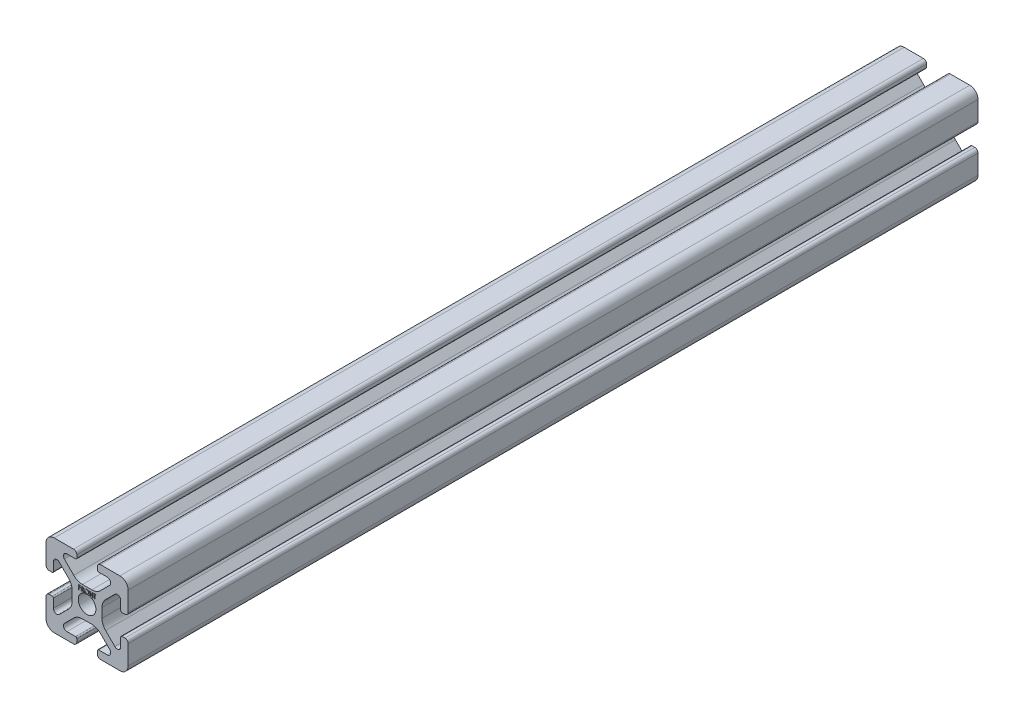
from build123d import *

# Parameters (mm, degrees)
SKETCH1_R           = 2.1463
BOSS_EXTRUDE1_DEPTH = 206.82
WRAP1_DEPTH         = 0.1


# Read off the part's stored shape, not the designer's step: Wrap1
with BuildPart() as part:
    # Sketch1 → Boss-Extrude1 (new body)
    with BuildSketch(Plane.XY):
        with BuildLine():
            Line((-9.9949, 7.9883), (-9.9949, 3.2893))
            ThreePointArc((-9.9949, 3.2893), (-9.76427588, 2.73252412), (-9.2075, 2.5019))
            Line((-9.2075, 2.5019), (-8.4963, 2.5019))
            ThreePointArc((-8.4963, 2.5019), (-8.280773853, 2.591173853), (-8.1915, 2.8067))
            Line((-8.1915, 2.8067), (-8.1915, 4.9149))
            ThreePointArc((-8.1915, 4.9149), (-7.674065253, 5.689295824), (-6.760603096, 5.507596904))
            Line((-6.760603096, 5.507596904), (-4.505765747, 3.252759555))
            ThreePointArc((-4.505765747, 3.252759555), (-3.856054457, 2.280397894), (-3.627906192, 1.133419111))
            Line((-3.627906192, 1.133419111), (-3.627906192, -1.133419111))
            ThreePointArc((-3.627906192, -1.133419111), (-3.856054457, -2.280397894), (-4.505765747, -3.252759555))
            Line((-4.505765747, -3.252759555), (-6.760603096, -5.507596904))
            ThreePointArc((-6.760603096, -5.507596904), (-7.674065253, -5.689295824), (-8.1915, -4.9149))
            Line((-8.1915, -4.9149), (-8.1915, -2.8067))
            ThreePointArc((-8.1915, -2.8067), (-8.280773853, -2.591173853), (-8.4963, -2.5019))
            Line((-8.4963, -2.5019), (-9.2075, -2.5019))
            ThreePointArc((-9.2075, -2.5019), (-9.76427588, -2.73252412), (-9.9949, -3.2893))
            Line((-9.9949, -3.2893), (-9.9949, -7.9883))
            ThreePointArc((-9.9949, -7.9883), (-9.407180467, -9.407180467), (-7.9883, -9.9949))
            Line((-7.9883, -9.9949), (-3.2893, -9.9949))
            ThreePointArc((-3.2893, -9.9949), (-2.73252412, -9.76427588), (-2.5019, -9.2075))
            Line((-2.5019, -9.2075), (-2.5019, -8.4963))
            ThreePointArc((-2.5019, -8.4963), (-2.591173853, -8.280773853), (-2.8067, -8.1915))
            Line((-2.8067, -8.1915), (-4.9149, -8.1915))
            ThreePointArc((-4.9149, -8.1915), (-5.689295824, -7.674065253), (-5.507596904, -6.760603096))
            Line((-5.507596904, -6.760603096), (-3.252759555, -4.505765747))
            ThreePointArc((-3.252759555, -4.505765747), (-2.280397894, -3.856054457), (-1.133419111, -3.627906192))
            Line((-1.133419111, -3.627906192), (1.133419111, -3.627906192))
            ThreePointArc((1.133419111, -3.627906192), (2.280397894, -3.856054457), (3.252759555, -4.505765747))
            Line((3.252759555, -4.505765747), (5.507596904, -6.760603096))
            ThreePointArc((5.507596904, -6.760603096), (5.689295824, -7.674065253), (4.9149, -8.1915))
            Line((4.9149, -8.1915), (2.8067, -8.1915))
            ThreePointArc((2.8067, -8.1915), (2.591173853, -8.280773853), (2.5019, -8.4963))
            Line((2.5019, -8.4963), (2.5019, -9.2075))
            ThreePointArc((2.5019, -9.2075), (2.73252412, -9.76427588), (3.2893, -9.9949))
            Line((3.2893, -9.9949), (7.9883, -9.9949))
            ThreePointArc((7.9883, -9.9949), (9.407180467, -9.407180467), (9.9949, -7.9883))
            Line((9.9949, -7.9883), (9.9949, -3.2893))
            ThreePointArc((9.9949, -3.2893), (9.76427588, -2.73252412), (9.2075, -2.5019))
            Line((9.2075, -2.5019), (8.4963, -2.5019))
            ThreePointArc((8.4963, -2.5019), (8.280773853, -2.591173853), (8.1915, -2.8067))
            Line((8.1915, -2.8067), (8.1915, -4.9149))
            ThreePointArc((8.1915, -4.9149), (7.674065253, -5.689295824), (6.760603096, -5.507596904))
            Line((6.760603096, -5.507596904), (4.505765747, -3.252759555))
            ThreePointArc((4.505765747, -3.252759555), (3.856054457, -2.280397894), (3.627906192, -1.133419111))
            Line((3.627906192, -1.133419111), (3.627906192, 1.133419111))
            ThreePointArc((3.627906192, 1.133419111), (3.856054457, 2.280397894), (4.505765747, 3.252759555))
            Line((4.505765747, 3.252759555), (6.760603096, 5.507596904))
            ThreePointArc((6.760603096, 5.507596904), (7.674065253, 5.689295824), (8.1915, 4.9149))
            Line((8.1915, 4.9149), (8.1915, 2.8067))
            ThreePointArc((8.1915, 2.8067), (8.280773853, 2.591173853), (8.4963, 2.5019))
            Line((8.4963, 2.5019), (9.2075, 2.5019))
            ThreePointArc((9.2075, 2.5019), (9.76427588, 2.73252412), (9.9949, 3.2893))
            Line((9.9949, 3.2893), (9.9949, 7.9883))
            ThreePointArc((9.9949, 7.9883), (9.407180467, 9.407180467), (7.9883, 9.9949))
            Line((7.9883, 9.9949), (3.2893, 9.9949))
            ThreePointArc((3.2893, 9.9949), (2.73252412, 9.76427588), (2.5019, 9.2075))
            Line((2.5019, 9.2075), (2.5019, 8.4963))
            ThreePointArc((2.5019, 8.4963), (2.591173853, 8.280773853), (2.8067, 8.1915))
            Line((2.8067, 8.1915), (4.9149, 8.1915))
            ThreePointArc((4.9149, 8.1915), (5.689295824, 7.674065253), (5.507596904, 6.760603096))
            Line((5.507596904, 6.760603096), (3.252759555, 4.505765747))
            ThreePointArc((3.252759555, 4.505765747), (2.280397894, 3.856054457), (1.133419111, 3.627906192))
            Line((1.133419111, 3.627906192), (-1.133419111, 3.627906192))
            ThreePointArc((-1.133419111, 3.627906192), (-2.280397894, 3.856054457), (-3.252759555, 4.505765747))
            Line((-3.252759555, 4.505765747), (-5.507596904, 6.760603096))
            ThreePointArc((-5.507596904, 6.760603096), (-5.689295824, 7.674065253), (-4.9149, 8.1915))
            Line((-4.9149, 8.1915), (-2.8067, 8.1915))
            ThreePointArc((-2.8067, 8.1915), (-2.591173853, 8.280773853), (-2.5019, 8.4963))
            Line((-2.5019, 8.4963), (-2.5019, 9.2075))
            ThreePointArc((-2.5019, 9.2075), (-2.73252412, 9.76427588), (-3.2893, 9.9949))
            Line((-3.2893, 9.9949), (-7.9883, 9.9949))
            ThreePointArc((-7.9883, 9.9949), (-9.407180467, 9.407180467), (-9.9949, 7.9883))
        make_face()
        Circle(SKETCH1_R, mode=Mode.SUBTRACT)
    extrude(amount=BOSS_EXTRUDE1_DEPTH)

    # Wrap1 outline → Wrap1 (add)
    # profile 1 of 5: a face of its own
    with BuildSketch(Plane.XY.offset(206.82)):
        with BuildLine():
            add(Edge.make_bspline(
                [(-1.158854167, 3.1463), (-1.145499559, 3.146255547), (-1.119857232, 3.146170192), (-1.083122011, 3.14569426), (-1.049742841, 3.144330158), (-1.019737172, 3.143156277), (-0.993105557, 3.141015722), (-0.969766331, 3.138969823), (-0.949826989, 3.136291634), (-0.937756745, 3.133804371), (-0.932291667, 3.132678205)],
                knots=[0, 0, 0, 0, 0.176257755, 0.338434414, 0.484822051, 0.617157578, 0.734698361, 0.837385184, 0.926372421, 1, 1, 1, 1], degree=3))
            Line((-1.158854167, 3.1463), (-1.358974359, 3.1463))
            Line((-1.358974359, 3.1463), (-1.358974359, 2.1463))
            Line((-1.358974359, 2.1463), (-1.269230769, 2.1463))
            Line((-1.269230769, 2.1463), (-1.269230769, 2.607838462))
            Line((-1.269230769, 2.607838462), (-1.196314103, 2.607838462))
            Line((-1.196314103, 2.607838462), (-0.828926282, 2.1463))
            Line((-0.828926282, 2.1463), (-0.717948718, 2.1463))
            Line((-0.717948718, 2.1463), (-1.085336538, 2.607838462))
            add(Edge.make_bspline(
                [(-0.730769231, 2.878872115), (-0.731188945, 2.8655478), (-0.732007915, 2.839548609), (-0.739643659, 2.801816929), (-0.752151236, 2.766619982), (-0.769386461, 2.734002085), (-0.791334883, 2.704599043), (-0.817713395, 2.678773199), (-0.848536712, 2.657161795), (-0.877230802, 2.64217528), (-0.902577717, 2.632577306), (-0.923444377, 2.625824061), (-0.946206371, 2.620606356), (-0.970645609, 2.615932033), (-0.996863797, 2.612402977), (-1.024798094, 2.609818236), (-1.054468423, 2.608202794), (-1.074851014, 2.607962221), (-1.085336538, 2.607838462)],
                knots=[0, 0, 0, 0, 0.078780236, 0.153720644, 0.22671353, 0.299191166, 0.371189997, 0.443006414, 0.516689173, 0.593217217, 0.633872918, 0.676989142, 0.722899506, 0.771958611, 0.824211323, 0.879378651, 0.937948119, 1, 1, 1, 1], degree=3))
            add(Edge.make_bspline(
                [(-0.932291667, 3.132678205), (-0.924975488, 3.130870558), (-0.910499206, 3.127293825), (-0.88965633, 3.119733939), (-0.869795094, 3.110985475), (-0.850998002, 3.100710127), (-0.833359204, 3.088831618), (-0.81669683, 3.075555012), (-0.800935269, 3.060952953), (-0.786711946, 3.044657284), (-0.773300788, 3.027561138), (-0.761989752, 3.009074351), (-0.752239329, 2.989742486), (-0.744476324, 2.969368938), (-0.738225475, 2.948151289), (-0.733817978, 2.925897347), (-0.731174781, 2.902708497), (-0.73090568, 2.886891951), (-0.730769231, 2.878872115)],
                knots=[0, 0, 0, 0, 0.064216843, 0.127063766, 0.188744538, 0.249132103, 0.309452533, 0.369826676, 0.430650142, 0.492351932, 0.554072106, 0.615689784, 0.676797703, 0.738439048, 0.80131691, 0.865184512, 0.931641324, 1, 1, 1, 1], degree=3))
        make_face()
        with BuildLine():
            add(Edge.make_bspline(
                [(-1.086137821, 2.709000321), (-1.077589238, 2.708996539), (-1.06101965, 2.708989208), (-1.037048032, 2.710130287), (-1.014728, 2.711428378), (-0.994144928, 2.713413905), (-0.975289621, 2.715972783), (-0.958171502, 2.719173636), (-0.94276263, 2.722902796), (-0.924791619, 2.728674689), (-0.904724039, 2.737819266), (-0.882915051, 2.751123694), (-0.864342954, 2.767857728), (-0.848652136, 2.786993002), (-0.836043727, 2.80803193), (-0.827154569, 2.830722321), (-0.821513871, 2.854491349), (-0.820848572, 2.870827951), (-0.820512821, 2.879072436)],
                knots=[0, 0, 0, 0, 0.07166815, 0.138913286, 0.20118457, 0.259124428, 0.312255041, 0.36068151, 0.405086143, 0.445101659, 0.51877778, 0.589461579, 0.658462242, 0.727283218, 0.796322487, 0.863174893, 0.930949381, 1, 1, 1, 1], degree=3))
            Line((-1.086137821, 2.709000321), (-1.269230769, 2.710402564))
            Line((-1.269230769, 2.710402564), (-1.269230769, 3.043735897))
            Line((-1.269230769, 3.043735897), (-1.081730769, 3.043735897))
            add(Edge.make_bspline(
                [(-0.820512821, 2.879072436), (-0.820856284, 2.887114314), (-0.821536902, 2.903050382), (-0.827093693, 2.926380642), (-0.836490659, 2.948399771), (-0.849154156, 2.969018195), (-0.864582486, 2.98773412), (-0.88267329, 3.003747592), (-0.902931917, 3.016961725), (-0.921866545, 3.025405834), (-0.938790606, 3.030582935), (-0.953484794, 3.034226124), (-0.970088074, 3.037153115), (-0.988681062, 3.039498276), (-1.009184385, 3.041513974), (-1.031701714, 3.042871625), (-1.056083651, 3.043675586), (-1.072982774, 3.043715326), (-1.081730769, 3.043735897)],
                knots=[0, 0, 0, 0, 0.068814296, 0.136364825, 0.204019354, 0.273063739, 0.34291332, 0.410965444, 0.479168767, 0.549308007, 0.587651576, 0.630646669, 0.678878786, 0.731934299, 0.791111423, 0.85528319, 0.925085939, 1, 1, 1, 1], degree=3))
        make_face(mode=Mode.SUBTRACT)
    # profile 2 of 5: a face of its own
    with BuildSketch(Plane.XY.offset(206.82)):
        with BuildLine():
            add(Edge.make_bspline(
                [(0.487179487, 2.646700641), (0.486736649, 2.628712799), (0.485863765, 2.593256679), (0.478386971, 2.541215695), (0.466660971, 2.491189782), (0.449919181, 2.443262452), (0.428426187, 2.397383148), (0.401953281, 2.35367259), (0.370770078, 2.312116448), (0.335282406, 2.273169972), (0.296596394, 2.237456409), (0.255102032, 2.20633673), (0.211732512, 2.179558409), (0.166776254, 2.15858654), (0.136050476, 2.147480684), (0.120869489, 2.142893898)],
                knots=[0, 0, 0, 0, 0.065226504, 0.128568996, 0.190320378, 0.251377989, 0.312387528, 0.373788704, 0.43643116, 0.500566755, 0.564686795, 0.627135518, 0.688455409, 0.749245746, 0.806772651, 0.806772651, 0.806772651, 0.806772651], degree=3))
            add(Edge.make_bspline(
                [(-0.044871795, 3.171941026), (-0.026355193, 3.171472032), (0.01001294, 3.170550888), (0.063462911, 3.163499716), (0.114490081, 3.151301033), (0.163510121, 3.135054467), (0.209936685, 3.113381785), (0.254119226, 3.087186028), (0.295952619, 3.056192755), (0.334873013, 3.020641547), (0.370489285, 2.98196056), (0.40186811, 2.940681157), (0.428165908, 2.897052928), (0.449761847, 2.851206976), (0.466704307, 2.803246985), (0.478395462, 2.75291727), (0.485863505, 2.70054393), (0.486736584, 2.664821969), (0.487179487, 2.646700641)],
                knots=[0, 0, 0, 0, 0.066570035, 0.130749041, 0.1934128, 0.254989399, 0.316113556, 0.377261758, 0.439400784, 0.502970589, 0.566524976, 0.628231103, 0.689090611, 0.749344669, 0.810169593, 0.871609824, 0.934869184, 1, 1, 1, 1], degree=3))
            add(Edge.make_bspline(
                [(-0.564102564, 2.641892949), (-0.563949811, 2.653787997), (-0.563646232, 2.677428032), (-0.559991463, 2.712532775), (-0.55468812, 2.747072963), (-0.547087573, 2.780950377), (-0.537147097, 2.814082087), (-0.525417946, 2.84669659), (-0.511092276, 2.878463369), (-0.494897805, 2.909532909), (-0.476823003, 2.939420882), (-0.456858503, 2.967672192), (-0.435705541, 2.994523905), (-0.412516, 3.019280192), (-0.388054158, 3.042661237), (-0.361923193, 3.064307727), (-0.334282552, 3.084414856), (-0.3050133, 3.102534953), (-0.27483665, 3.118923278), (-0.243729, 3.132986664), (-0.212112836, 3.145056967), (-0.17984008, 3.15484006), (-0.146996431, 3.162563499), (-0.113510206, 3.167822743), (-0.079408085, 3.171486833), (-0.056433422, 3.171788977), (-0.044871795, 3.171941026)],
                knots=[0, 0, 0, 0, 0.043208986, 0.085872872, 0.128120007, 0.170151964, 0.211917621, 0.253753003, 0.296006409, 0.338443357, 0.381015368, 0.422820479, 0.464089056, 0.505125849, 0.545974971, 0.586985211, 0.628338592, 0.670083802, 0.711991602, 0.753039155, 0.794049395, 0.834885543, 0.875498313, 0.9165473, 0.958003779, 1, 1, 1, 1], degree=3))
            add(Edge.make_bspline(
                [(-0.181004049, 2.138654068), (-0.185187206, 2.139746153), (-0.205650494, 2.145368804), (-0.241653164, 2.157869199), (-0.287608859, 2.179474122), (-0.331463168, 2.20581823), (-0.373040067, 2.237077413), (-0.411994852, 2.272553578), (-0.44763748, 2.311174021), (-0.478711587, 2.352555237), (-0.50506162, 2.395885367), (-0.526594, 2.44128466), (-0.543640989, 2.488533643), (-0.555270937, 2.537947494), (-0.562795495, 2.589244496), (-0.563662594, 2.624171038), (-0.564102564, 2.641892949)],
                knots=[0.176365138, 0.176365138, 0.176365138, 0.176365138, 0.192071954, 0.253459424, 0.314569588, 0.376279881, 0.439025654, 0.503267029, 0.567492823, 0.629704796, 0.690999649, 0.751451651, 0.812004364, 0.873149681, 0.935635484, 1, 1, 1, 1], degree=3))
            ThreePointArc((-0.181004049, 2.138654068), (-0.030141921, 2.146088338), (0.120869489, 2.142893898))
        make_face()
        with BuildLine():
            add(Edge.make_bspline(
                [(-0.474358974, 2.64229359), (-0.473994728, 2.627847241), (-0.473278143, 2.599426804), (-0.467004552, 2.557778763), (-0.45734113, 2.517753538), (-0.443096168, 2.479570135), (-0.425281707, 2.44290034), (-0.403274024, 2.408069453), (-0.3772, 2.37506806), (-0.347581849, 2.344126555), (-0.315203933, 2.315884897), (-0.280823153, 2.291095351), (-0.244807837, 2.270120994), (-0.207064064, 2.253033831), (-0.167793339, 2.239493906), (-0.12674261, 2.230214297), (-0.084185336, 2.224107024), (-0.055176577, 2.223520522), (-0.040464744, 2.223223077)],
                knots=[0, 0, 0, 0, 0.064503999, 0.126899322, 0.18774654, 0.248149733, 0.308586065, 0.369583005, 0.431826965, 0.496179723, 0.560667855, 0.623504455, 0.685260411, 0.746536822, 0.808327352, 0.870486188, 0.934316883, 1, 1, 1, 1], degree=3))
            add(Edge.make_bspline(
                [(-0.040464744, 3.069376923), (-0.049954639, 3.06926124), (-0.068843705, 3.06903098), (-0.096925002, 3.065997919), (-0.124636983, 3.061675093), (-0.151985372, 3.055508944), (-0.17885574, 3.047107786), (-0.205498552, 3.037438956), (-0.231670853, 3.025661501), (-0.257286241, 3.012355014), (-0.28211912, 2.997626751), (-0.30555132, 2.981349103), (-0.327643504, 2.963903802), (-0.34834158, 2.945250134), (-0.367584772, 2.925293105), (-0.38575183, 2.904335266), (-0.402114567, 2.881777583), (-0.417110447, 2.858231753), (-0.430529829, 2.833728444), (-0.442462788, 2.808525626), (-0.452223933, 2.782417715), (-0.460184612, 2.755687956), (-0.466784558, 2.728378682), (-0.470965679, 2.700282725), (-0.474032068, 2.671541265), (-0.474249167, 2.652117878), (-0.474358974, 2.64229359)],
                knots=[0, 0, 0, 0, 0.042023329, 0.083644911, 0.124983795, 0.166247461, 0.207701556, 0.249631071, 0.29174177, 0.334742875, 0.377460169, 0.419556319, 0.461044176, 0.502096284, 0.542890714, 0.583800819, 0.624863583, 0.666224689, 0.707399186, 0.748556678, 0.789654591, 0.830739726, 0.872070142, 0.913993395, 0.95649813, 1, 1, 1, 1], degree=3))
            add(Edge.make_bspline(
                [(0.397435897, 2.646900962), (0.397321294, 2.656591106), (0.397093956, 2.675813291), (0.394081821, 2.704230668), (0.38976728, 2.7320173), (0.383549364, 2.759064101), (0.375535034, 2.785377965), (0.36565294, 2.810934179), (0.353999997, 2.835827949), (0.340626219, 2.859997748), (0.325593126, 2.88319053), (0.3091662, 2.905362648), (0.291061814, 2.926097717), (0.271797236, 2.94590763), (0.250891269, 2.964369884), (0.228438613, 2.981490604), (0.204711848, 2.997682968), (0.179589781, 3.012290271), (0.153662937, 3.025780052), (0.127058949, 3.037337482), (0.100079206, 3.047158087), (0.072792317, 3.055534363), (0.044968609, 3.061650943), (0.016796086, 3.066001814), (-0.011686273, 3.069029925), (-0.030841479, 3.06926089), (-0.040464744, 3.069376923)],
                knots=[0, 0, 0, 0, 0.042915082, 0.085129971, 0.126473319, 0.167453038, 0.207976333, 0.248249378, 0.288749987, 0.329669857, 0.370537287, 0.411128564, 0.451818913, 0.492405877, 0.533485862, 0.575263062, 0.617440613, 0.660671688, 0.703940204, 0.746867522, 0.7890793, 0.831104042, 0.87323799, 0.91516577, 0.957380658, 1, 1, 1, 1], degree=3))
            add(Edge.make_bspline(
                [(-0.040464744, 2.223223077), (-0.030576315, 2.223358935), (-0.01096459, 2.223628383), (0.018205559, 2.226342291), (0.046850191, 2.230694254), (0.074929128, 2.236960155), (0.102410503, 2.244802214), (0.129409018, 2.254118708), (0.155637101, 2.265741909), (0.181425626, 2.278584181), (0.206110267, 2.293224226), (0.229674705, 2.308949412), (0.251524985, 2.326369017), (0.272207576, 2.344745535), (0.291529773, 2.364449492), (0.309360912, 2.385455269), (0.325640949, 2.407895457), (0.340631134, 2.431405573), (0.354003495, 2.455975931), (0.365654666, 2.481270125), (0.375539271, 2.50722587), (0.383518843, 2.533880605), (0.389771832, 2.561183705), (0.394080381, 2.589171727), (0.397094221, 2.617788682), (0.397321385, 2.637144069), (0.397435897, 2.646900962)],
                knots=[0, 0, 0, 0, 0.043633218, 0.086537777, 0.129177336, 0.171436324, 0.213415895, 0.255265955, 0.297369481, 0.339940748, 0.382347459, 0.423952947, 0.464871163, 0.505572294, 0.546002577, 0.586567975, 0.627064799, 0.668270684, 0.709549225, 0.750428154, 0.791096194, 0.832027145, 0.873135955, 0.914610764, 0.956955986, 1, 1, 1, 1], degree=3))
        make_face(mode=Mode.SUBTRACT)
    # profile 3 of 5: a face of its own
    with BuildSketch(Plane.XY.offset(206.82)):
        Polygon((-1.935897436, 3.043735897), (-1.538461538, 3.043735897), (-1.538461538, 3.1463), (-2.025641026, 3.1463), (-2.025641026, 2.1463), (-1.935897436, 2.1463), (-1.935897436, 2.633479487), (-1.538461538, 2.633479487), (-1.538461538, 2.73604359), (-1.935897436, 2.73604359), align=None)
    # profile 4 of 5: a face of its own
    with BuildSketch(Plane.XY.offset(206.82)):
        Polygon((1.91025641, 2.1463), (1.91025641, 3.043735897), (2.128205128, 3.043735897), (2.128205128, 3.1463), (1.602564103, 3.1463), (1.602564103, 3.043735897), (1.820512821, 3.043735897), (1.820512821, 2.1463), align=None)
    # profile 5 of 5: a face of its own
    with BuildSketch(Plane.XY.offset(206.82)):
        Polygon((0.782051282, 2.93155641), (1.441105769, 2.1463), (1.461538462, 2.1463), (1.461538462, 3.1463), (1.371794872, 3.1463), (1.371794872, 2.359240705), (0.711137821, 3.1463), (0.692307692, 3.1463), (0.692307692, 2.1463), (0.782051282, 2.1463), align=None)
    extrude(amount=WRAP1_DEPTH)


solid = part.part
